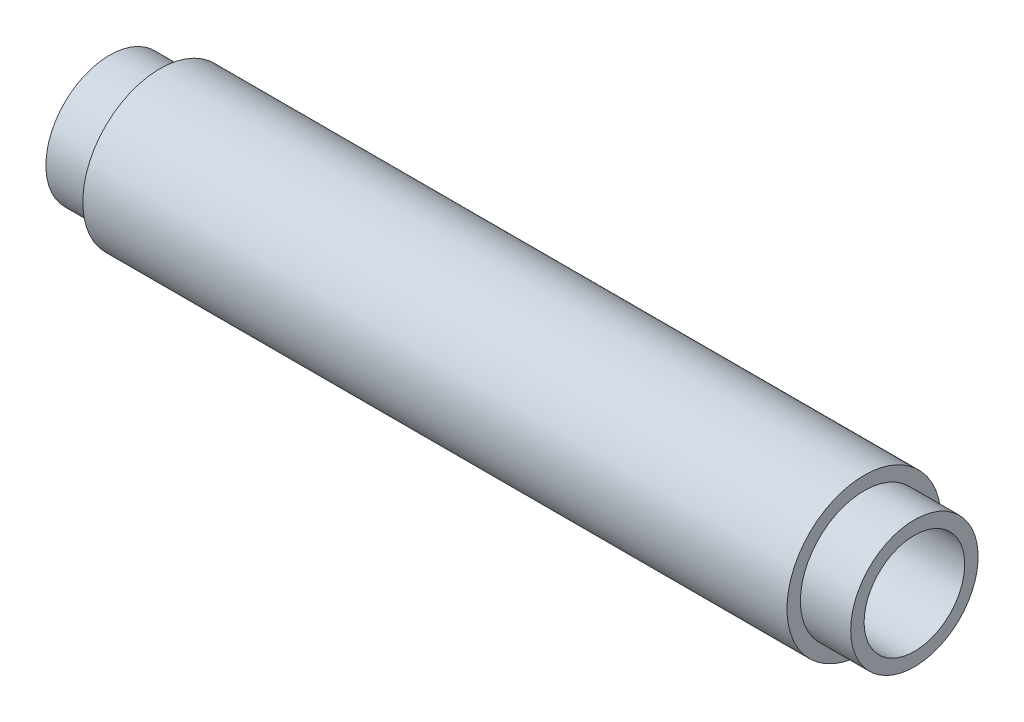
from build123d import *
from build123d.topology import SkipClean

# Parameters (mm, degrees)
SWEEP_THIN1_PROFILE_R   = 14.605
SWEEP_THIN1_PROFILE_R_2 = 9.525
SKETCH15_R              = 12.065
SKETCH15_R_2            = 9.525
BOSS_EXTRUDE2_DEPTH     = 9.525


with BuildPart() as part:
    # Sweep-Thin1: sweep along a curve in space
    with BuildLine() as sweep_thin1_path:
        Line((-66.675, 0, 0), (66.675, 0, 0))
    # Sweep-Thin1 profile (on start of the path) → Sweep-Thin1 (sweep)
    with BuildSketch(Plane(origin=(-66.675, 0, 0), x_dir=(0, 0, 1), z_dir=(1, 0, 0))):
        Circle(SWEEP_THIN1_PROFILE_R)
        Circle(SWEEP_THIN1_PROFILE_R_2, mode=Mode.SUBTRACT)
    sweep(path=sweep_thin1_path.line)

    # Sketch15 → Boss-Extrude2 (add)
    with SkipClean():  # the faces are left unmerged after this step: merging them gives an invalid solid
        with BuildSketch(Plane.ZY.offset(66.675)):
            with Locations(Location((0, 0, 0), (0, 0, 180))):
                Circle(SKETCH15_R)
            with Locations(Location((0, 0, 0), (0, 0, 180))):
                Circle(SKETCH15_R_2, mode=Mode.SUBTRACT)
        boss_extrude2 = extrude(amount=BOSS_EXTRUDE2_DEPTH)
    add(part.part.scale(1), mode=Mode.REPLACE)  # the faces are merged on a copy

    # Mirror1: Boss-Extrude2 across plane
    with SkipClean():  # the faces are left unmerged after this step: merging them gives an invalid solid
        add(boss_extrude2.mirror(Plane(origin=(0, 0, 0), x_dir=(0, 0, 1), z_dir=(1, 0, 0))))


solid = part.part
